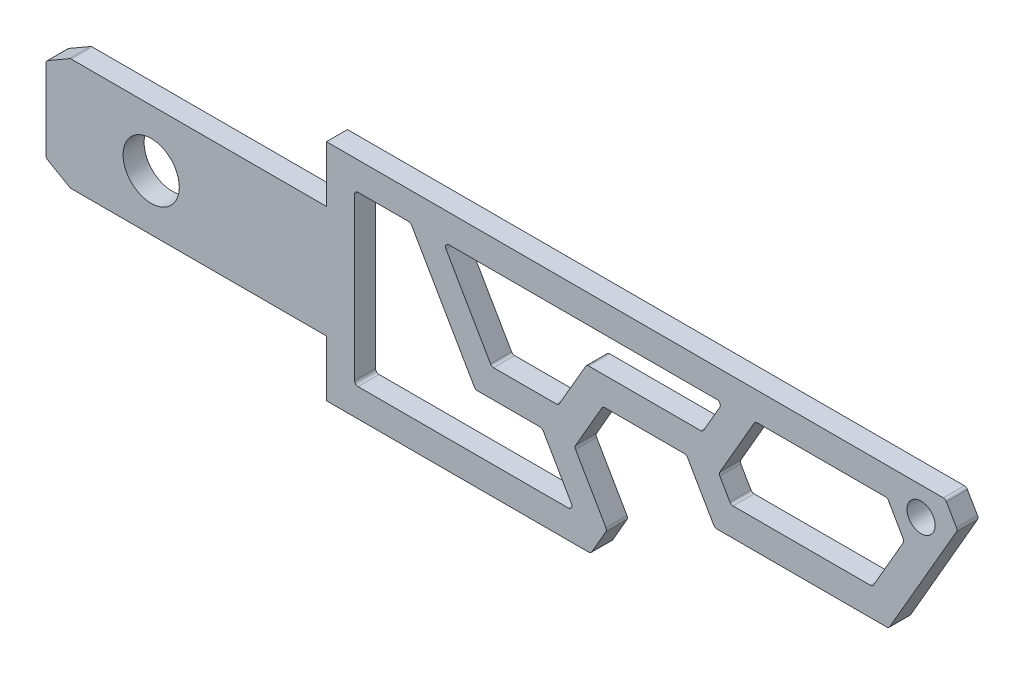
from build123d import *

# Parameters (mm, degrees)
SKETCH_1_R      = 2.01
SKETCH_1_R_2    = 4.01
EXTRUDE_1_DEPTH = 1.5
FILLET_1_R      = 0.5


with BuildPart() as part:
    # 草图1 → 凸台-拉伸1 (new, symmetric)
    with BuildSketch(Plane.XY):
        Polygon((88.267949192, 16), (0, 16), (0, 8), (-36.535898385, 8), (-40, 6), (-40, -6), (-36.535898385, -8), (0, -8), (0, -16), (37.690598923, -16), (40, -12), (35.381197846, -4), (39.422649731, 3), (51.339745962, 3), (55.381197846, -4), (80.185045424, -4), (90, 13), align=None)
        Polygon((21.237604307, -4), (30.762395693, -4), (35.381197846, -12), (4, -12), (4, 12), (12, 12), align=None, mode=Mode.SUBTRACT)
        Polygon((23.547005384, 0), (16.618802154, 12), (56.535898385, 12), (53.649147039, 7), (37.113248654, 7), (33.07179677, 0), align=None, mode=Mode.SUBTRACT)
        Polygon((57.690598923, 0), (55.958548116, 3), (61.154700538, 12), (80, 12), (82.401923789, 7.839745962), (77.875644347, 0), align=None, mode=Mode.SUBTRACT)
        with Locations((84.8, 12)):
            Circle(SKETCH_1_R, mode=Mode.SUBTRACT)
        with Locations((-25, -0.10857011)):
            Circle(SKETCH_1_R_2, mode=Mode.SUBTRACT)
    extrude(amount=EXTRUDE_1_DEPTH, both=True)

    # 圆角1
    fillet_1_edges = [part.edges().sort_by_distance(p)[0] for p in [
        (53.649147039, 7, 0),
        (37.113248654, 7, 0),
        (33.07179677, 0, 0),
        (23.547005384, 0, 0),
        (57.690598923, 0, 0),
        (61.154700538, 12, 0),
        (55.958548116, 3, 0),
        (77.875644347, 0, 0),
        (82.401923789, 7.839745962, 0),
        (80, 12, 0),
        (88.267949192, 16, 0),
        (37.690598923, -16, 0),
        (80.185045424, -4, 0),
        (55.381197846, -4, 0),
        (51.339745962, 3, 0),
        (35.381197846, -4, 0),
        (39.422649731, 3, 0),
        (-36.535898385, -8, 0),
        (-40, -6, 0),
        (-36.535898385, 8, 0),
        (-40, 6, 0),
        (90, 13, 0),
        (40, -12, 0),
        (35.381197846, -12, 0),
        (30.762395693, -4, 0),
        (21.237604307, -4, 0),
        (4, -12, 0),
        (12, 12, 0),
        (4, 12, 0),
        (56.535898385, 12, 0),
        (16.618802154, 12, 0),
    ]]
    fillet(fillet_1_edges, radius=FILLET_1_R)


solid = part.part
